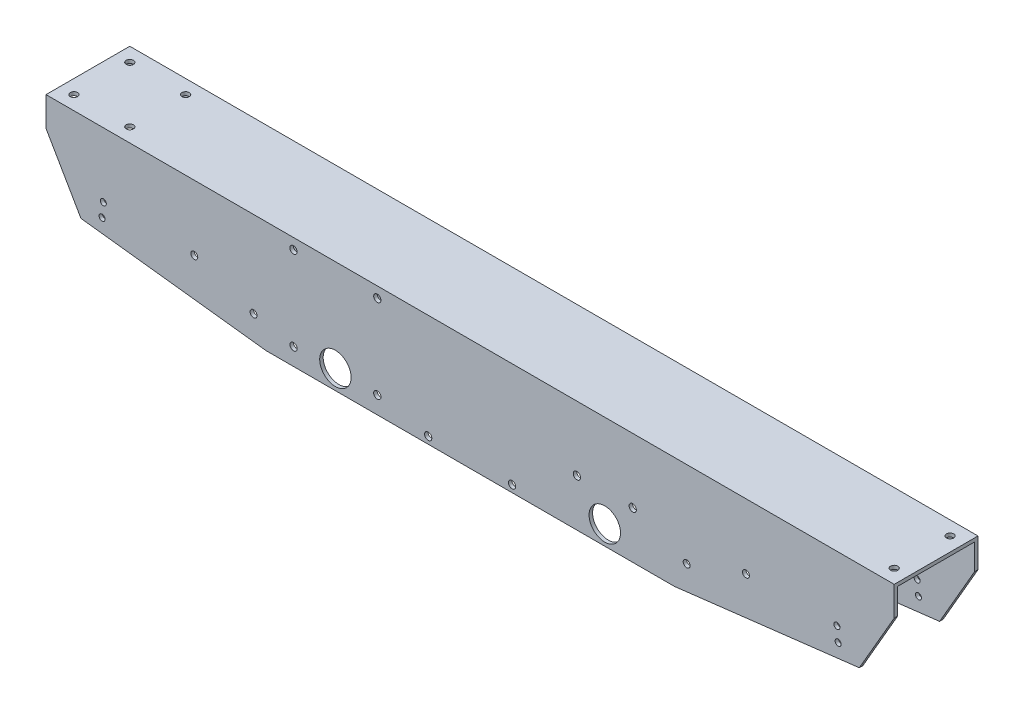
from build123d import *

# Parameters (mm, degrees)
BOSS_EXTRUDE1_DEPTH                     = 385.705756272
SKETCH2_R                               = 2.749999961
SKETCH2_R_2                             = 2.75
SKETCH2_R_3                             = 3.302
SKETCH2_R_4                             = 14.2875
AXLES_DEPTH                             = 141.732
FLANIGAN_MOUNTING_HOLES_R               = 3.3
FLANIGAN_MOUNTING_HOLES_EXTRUSION_DEPTH = 397.429073633
BEVELED_ENDS_DEPTH                      = 101.6
SKETCH32_R                              = 3.3
BELT_SHIELD_HOLES_DEPTH                 = 397.429073633
SKETCH37_R                              = 3.3
TOP_HOLES_DEPTH                         = 401.678300412
SKETCH38_R                              = 3.15
CUT_EXTRUDE1_DEPTH                      = 397.429073633


with BuildPart() as part:
    # Sketch1 → Boss-Extrude1 (new, symmetric)
    with BuildSketch(Plane(origin=(0, 0, 0), x_dir=(0, 0, -1), z_dir=(1, 0, 0))):
        Polygon((-38.1, 50.8), (38.1, 50.8), (38.1, -50.8), (34.925, -50.8), (34.925, 47.625), (-34.925, 47.625), (-34.925, -50.8), (-38.1, -50.8), align=None)
    extrude(amount=BOSS_EXTRUDE1_DEPTH, both=True)

    # Sketch2 → Axles (cut)
    with BuildSketch(Plane.XY.offset(38.1)):
        with Locations((-333.577237048, -7.874)):
            Circle(SKETCH2_R)
        with Locations((334.720333616, -20.574)):
            Circle(SKETCH2_R_2)
        with Locations((333.577237048, -7.874)):
            Circle(SKETCH2_R)
        with Locations((-160.6, -35.12)):
            Circle(SKETCH2_R_3)
        with Locations((-160.6, 41.08)):
            Circle(SKETCH2_R_3)
        with Locations((-122.5, -33.274)):
            Circle(SKETCH2_R_4)
        with Locations((-334.720333616, -20.574)):
            Circle(SKETCH2_R_2)
        with Locations((-84.4, 41.08)):
            Circle(SKETCH2_R_3)
        with Locations((-84.4, -35.12)):
            Circle(SKETCH2_R_3)
        with Locations((122.5, -33.274)):
            Circle(SKETCH2_R_4)
    extrude(amount=-AXLES_DEPTH, mode=Mode.SUBTRACT)

    # Flanigan mounting holes → Flanigan mounting holes extrusion (cut, through all)
    with BuildSketch(Plane.XY.offset(38.1)):
        with Locations((97.1, -7.87)):
            Circle(FLANIGAN_MOUNTING_HOLES_R)
        with Locations((147.9, -7.87)):
            Circle(FLANIGAN_MOUNTING_HOLES_R)
    extrude(amount=-FLANIGAN_MOUNTING_HOLES_EXTRUSION_DEPTH, mode=Mode.SUBTRACT)

    # Sketch16 → Beveled ends (cut)
    with BuildSketch(Plane.XY.offset(38.1)):
        Polygon((-353.951491467, -30.8), (-185.705756272, -50.8), (-385.705756272, -50.8), (-385.705756272, 24.2), align=None)
        Polygon((385.705756272, -50.8), (185.705756272, -50.8), (353.951491467, -30.8), (385.705756272, 24.2), align=None)
    extrude(amount=-BEVELED_ENDS_DEPTH, mode=Mode.SUBTRACT)

    # Sketch32 → Belt shield holes (cut, through all)
    with BuildSketch(Plane(origin=(0, 0, -38.1), x_dir=(-1, 0, 0), z_dir=(0, 0, -1))):
        with Locations((-38.1, -44.45)):
            Circle(SKETCH32_R)
        with Locations((38.1, -44.45)):
            Circle(SKETCH32_R)
    extrude(amount=-BELT_SHIELD_HOLES_DEPTH, mode=Mode.SUBTRACT)

    # Sketch37 → Top holes (cut, through all)
    with BuildSketch(Plane(origin=(0, 50.8, 0), x_dir=(1, 0, 0), z_dir=(0, 1, 0))):
        with Locations((373.005756272, 25.4)):
            Circle(SKETCH37_R)
        with Locations((373.005756272, -25.4)):
            Circle(SKETCH37_R)
        with Locations((-322.205756272, 25.4)):
            Circle(SKETCH37_R)
        with Locations((-322.205756272, -25.4)):
            Circle(SKETCH37_R)
        with Locations((-373.005756272, 25.4)):
            Circle(SKETCH37_R)
        with Locations((-373.005756272, -25.4)):
            Circle(SKETCH37_R)
    extrude(amount=-TOP_HOLES_DEPTH, mode=Mode.SUBTRACT)

    # Sketch38 → Cut-Extrude1 (cut, through all)
    with BuildSketch(Plane.XY.offset(38.1)):
        with Locations((-250.831756272, -8.382)):
            Circle(SKETCH38_R)
        with Locations((-196.924747031, -27.359798996)):
            Circle(SKETCH38_R)
        with Locations((196.924747031, -27.359798996)):
            Circle(SKETCH38_R)
        with Locations((250.831756272, -8.382)):
            Circle(SKETCH38_R)
    extrude(amount=-CUT_EXTRUDE1_DEPTH, mode=Mode.SUBTRACT)


solid = part.part
